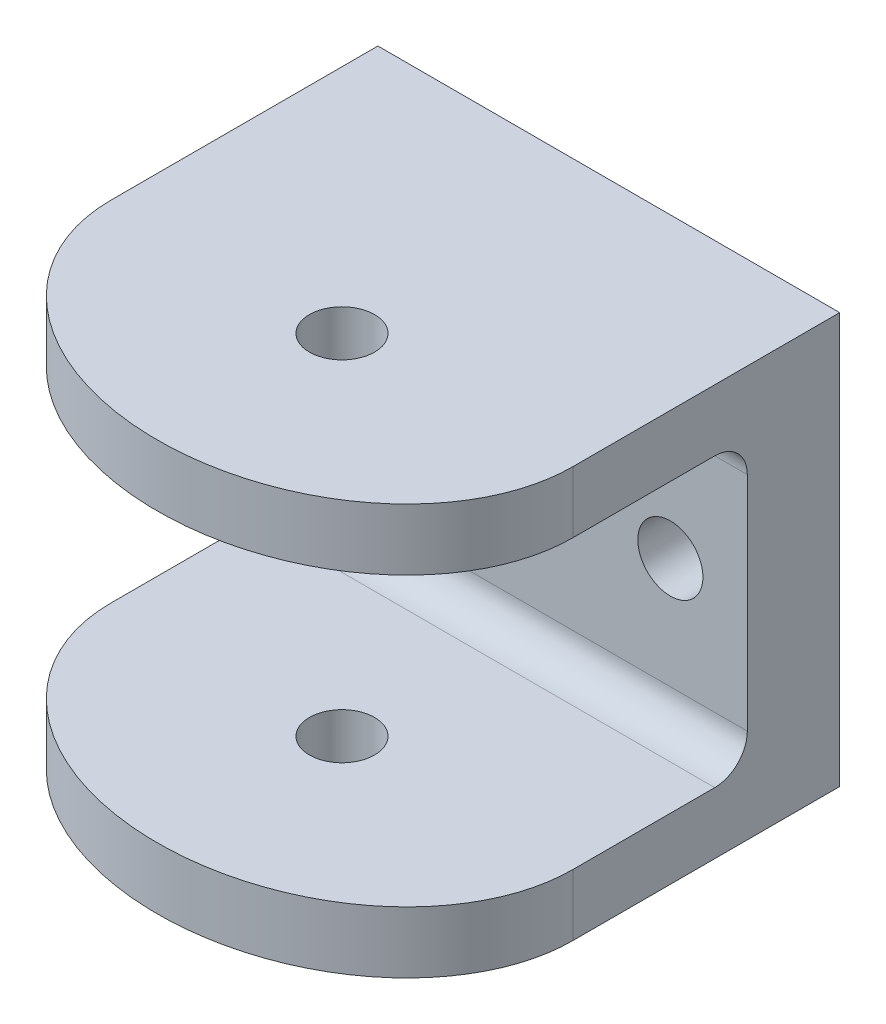
from build123d import *

# Parameters (mm, degrees)
SKETCH1_W           = 45
SKETCH1_H           = 40
SKETCH1_R           = 3.175
BOSS_EXTRUDE1_DEPTH = 9
SKETCH2_W           = 45
SKETCH2_H           = 6
BOSS_EXTRUDE2_DEPTH = 35
FILLET1_R           = 3.175
SKETCH3_R           = 3.175
CUT_EXTRUDE1_DEPTH  = 64.578691399


with BuildPart() as part:
    # Sketch1 → Boss-Extrude1 (new body)
    with BuildSketch(Plane.XY):
        Rectangle(SKETCH1_W, SKETCH1_H)
        with Locations((15, 0)):
            Circle(SKETCH1_R, mode=Mode.SUBTRACT)
        with Locations((-15, 0)):
            Circle(SKETCH1_R, mode=Mode.SUBTRACT)
    extrude(amount=BOSS_EXTRUDE1_DEPTH)

    # Sketch2 → Boss-Extrude2 (add)
    with BuildSketch(Plane.XY.offset(9)):
        with Locations((0, 17)):
            Rectangle(SKETCH2_W, SKETCH2_H)
        with Locations((0, -17)):
            Rectangle(SKETCH2_W, SKETCH2_H)
    extrude(amount=BOSS_EXTRUDE2_DEPTH)

    # Fillet1
    fillet1_edges = [part.edges().sort_by_distance(p)[0] for p in [
        (0, 14, 9),
        (0, -14, 9),
    ]]
    fillet(fillet1_edges, radius=FILLET1_R)

    # Sketch3 → Cut-Extrude1 (cut, through all)
    with BuildSketch(Plane(origin=(0, 20, 0), x_dir=(1, 0, 0), z_dir=(0, 1, 0))):
        with BuildLine():
            Line((9.08e-07, -44), (22.5, -44))
            Line((22.5, -44), (22.5, -26))
            add(Edge.make_bspline(
                [(9.08e-07, -44), (7.181949883, -43.99999957), (13.035725314, -40.671220242), (22.4999996, -35.289312281), (22.5, -26)],
                knots=[1.530551828, 1.530551828, 1.530551828, 2.188746363, 2.188746363, 3.155795213, 3.155795213, 3.155795213], degree=2, weights=[0.772303258, 0.837192571, 1, 0.760796044, 0.732965973]))
        make_face()
        with BuildLine():
            Line((-22.5, -44), (9.08e-07, -44))
            add(Edge.make_bspline(
                [(-22.5, -26.000001723), (-22.499998622, -44.000001347), (9.08e-07, -44)],
                knots=[0, 0, 0, 1.530551828, 1.530551828, 1.530551828], degree=2, weights=[1, 0.621411005, 0.772303258]))
            Line((-22.5, -26.000001723), (-22.5, -44))
        make_face()
        with Locations((0, -26)):
            Circle(SKETCH3_R)
    extrude(amount=-CUT_EXTRUDE1_DEPTH, mode=Mode.SUBTRACT)


solid = part.part
